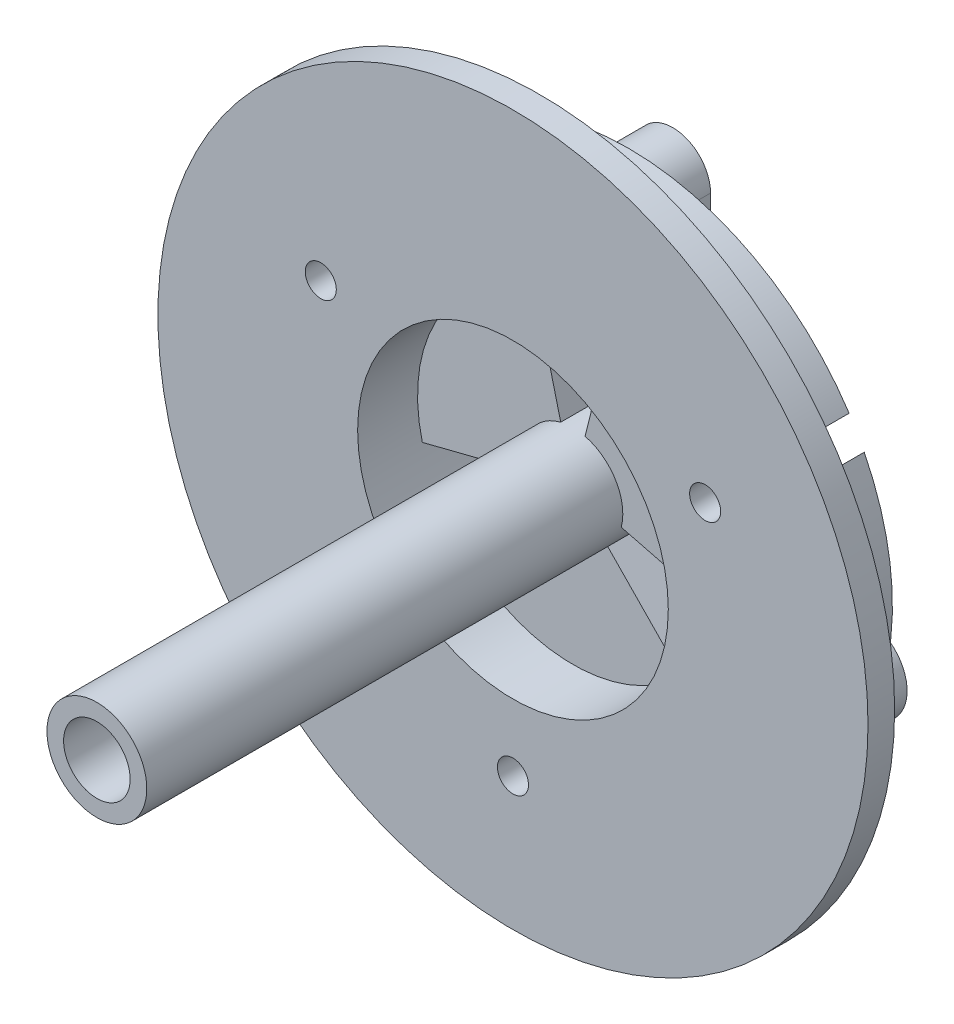
from build123d import *
from build123d.topology import SkipClean

# Parameters (mm, degrees)
SKETCH_1_R          = 16
EXTRUDE_1_DEPTH     = 1.2
SKETCH_2_R          = 7
CUT_EXTRUDE_1_DEPTH = 1.2
SKETCH_3_R          = 0.7
CUT_EXTRUDE_2_DEPTH = 1.2
SKETCH_4_R          = 0.9
EXTRUDE_2_DEPTH     = 6
SKETCH_5_R          = 7
CUT_EXTRUDE_3_DEPTH = 11
SKETCH_6_R          = 11.9
SKETCH_6_R_2        = 7
EXTRUDE_3_DEPTH     = 4
SKETCH_7_R          = 0.7
CUT_EXTRUDE_4_DEPTH = 13
SKETCH_8_R          = 2.25
EXTRUDE_4_DEPTH     = 33
EXTRUDE_START       = -2.5
EXTRUDE_5_DEPTH     = 2.5
SKETCH_10_R         = 1.5
CUT_EXTRUDE_5_DEPTH = 33.5
SKETCH_12_W         = 13.813743992
SKETCH_12_H         = 10.461201588
CUT_EXTRUDE_6_DEPTH = 16.75
SKETCH_13_R         = 2
CUT_EXTRUDE_7_DEPTH = 1.5


with BuildPart() as part:
    # 草图1 → 凸台-拉伸1 (new body)
    with BuildSketch(Plane.XY):
        Circle(SKETCH_1_R)
    extrude(amount=EXTRUDE_1_DEPTH)

    # 草图2 → 切除-拉伸1 (cut)
    with BuildSketch(Plane.XY.offset(1.2)):
        Circle(SKETCH_2_R)
    extrude(amount=-CUT_EXTRUDE_1_DEPTH, mode=Mode.SUBTRACT)

    # 草图3 → 切除-拉伸2 (cut)
    with BuildSketch(Plane.XY.offset(1.2)):
        with Locations((8.660254038, 5)):
            Circle(SKETCH_3_R)
        with Locations((0, -10)):
            Circle(SKETCH_3_R)
        with Locations((-8.660254038, 5)):
            Circle(SKETCH_3_R)
    extrude(amount=-CUT_EXTRUDE_2_DEPTH, mode=Mode.SUBTRACT)

    # 草图4 → 凸台-拉伸2 (add)
    # profile 1 of 3: a face of its own
    with BuildSketch(Plane(origin=(0, 0, 0), x_dir=(-1, 0, 0), z_dir=(0, 0, -1))):
        with BuildLine():
            Line((1.703894623, 10), (1.703894623, 5.395195442))
            Line((1.703894623, 5.395195442), (-1.703894623, 5.395195442))
            Line((-1.703894623, 5.395195442), (-1.703894623, 10))
            ThreePointArc((-1.703894623, 10), (0, 11.703894623), (1.703894623, 10))
        make_face()
        with Locations((0, 10)):
            Circle(SKETCH_4_R, mode=Mode.SUBTRACT)
    # profile 2 of 3: a face of its own
    with BuildSketch(Plane(origin=(0, 0, 0), x_dir=(-1, 0, 0), z_dir=(0, 0, -1))):
        with BuildLine():
            Line((-5.537946003, -1.003403593), (-3.637946003, -4.294300127))
            Line((-3.637946003, -4.294300127), (-7.710254038, -6.645448267))
            ThreePointArc((-7.710254038, -6.645448267), (-10.305702305, -5.95), (-9.610254038, -3.354551733))
            Line((-9.610254038, -3.354551733), (-5.537946003, -1.003403593))
        make_face()
        with Locations((-8.660254038, -5)):
            Circle(SKETCH_4_R, mode=Mode.SUBTRACT)
    # profile 3 of 3: a face of its own
    with BuildSketch(Plane(origin=(0, 0, 0), x_dir=(-1, 0, 0), z_dir=(0, 0, -1))):
        with BuildLine():
            Line((3.637946003, -4.294300127), (5.537946003, -1.003403593))
            Line((5.537946003, -1.003403593), (9.610254038, -3.354551733))
            ThreePointArc((9.610254038, -3.354551733), (10.305702305, -5.95), (7.710254038, -6.645448267))
            Line((7.710254038, -6.645448267), (3.637946003, -4.294300127))
        make_face()
        with Locations((8.660254038, -5)):
            Circle(SKETCH_4_R, mode=Mode.SUBTRACT)
    extrude(amount=EXTRUDE_2_DEPTH)

    # 草图5 → 切除-拉伸3 (cut)
    with BuildSketch(Plane.XY.offset(1.2)):
        Circle(SKETCH_5_R)
    extrude(amount=-CUT_EXTRUDE_3_DEPTH, mode=Mode.SUBTRACT)

    # 草图6 → 凸台-拉伸3 (add)
    with SkipClean():  # the faces are left unmerged after this step: merging them gives an invalid solid
        with BuildSketch(Plane(origin=(0, 0, 0), x_dir=(-1, 0, 0), z_dir=(0, 0, -1))):
            Circle(SKETCH_6_R)
            Circle(SKETCH_6_R_2, mode=Mode.SUBTRACT)
        extrude(amount=EXTRUDE_3_DEPTH)

    # 草图7 → 切除-拉伸4 (cut)
    with SkipClean():  # the faces are left unmerged after this step: merging them gives an invalid solid
        with BuildSketch(Plane.XY.offset(1.2)):
            with Locations((-8.660254038, 5)):
                Circle(SKETCH_7_R)
            with Locations((8.660254038, 5)):
                Circle(SKETCH_7_R)
            with Locations((0, -10)):
                Circle(SKETCH_7_R)
        extrude(amount=-CUT_EXTRUDE_4_DEPTH, mode=Mode.SUBTRACT)



with BuildPart() as body_2:
    # 草图8 → 凸台-拉伸4 (new body)
    with BuildSketch(Plane(origin=(0, 0, -4), x_dir=(-1, 0, 0), z_dir=(0, 0, -1))):
        Circle(SKETCH_8_R)
    extrude(amount=-EXTRUDE_4_DEPTH)


with BuildPart() as part_1:
    with SkipClean():  # the faces are left unmerged after this step: merging them gives an invalid solid
        add(part.part)

        add(body_2.part)  # 凸台-拉伸5 merges body 2
        # 草图9 → 凸台-拉伸5 (add)
        with BuildSketch(Plane(origin=(0, 0, -4), x_dir=(-1, 0, 0), z_dir=(0, 0, -1)).offset(EXTRUDE_START)):
            with BuildLine():
                Line((-1.570048426, -1.611659996), (-4.884595102, -5.01405332))
                ThreePointArc((-4.884595102, -5.01405332), (0, -7), (4.884595102, -5.01405332))
                Line((4.884595102, -5.01405332), (1.570048426, -1.611659996))
                ThreePointArc((1.570048426, -1.611659996), (0, -2.25), (-1.570048426, -1.611659996))
            make_face()
            with BuildLine():
                Line((-2.180762711, -0.553871824), (-6.784595102, -1.723156785))
                ThreePointArc((-6.784595102, -1.723156785), (-6.010804278, 3.587510548), (-1.703894623, 6.789458234))
                Line((-1.703894623, 6.789458234), (-0.547680415, 2.182325861))
                ThreePointArc((-0.547680415, 2.182325861), (-1.932044232, 1.15312839), (-2.180762711, -0.553871824))
            make_face()
            with BuildLine():
                Line((0.547680415, 2.182325861), (1.703894623, 6.789458234))
                ThreePointArc((1.703894623, 6.789458234), (6.010804278, 3.587510548), (6.784595102, -1.723156785))
                Line((6.784595102, -1.723156785), (2.180762711, -0.553871824))
                ThreePointArc((2.180762711, -0.553871824), (1.932044232, 1.15312839), (0.547680415, 2.182325861))
            make_face()
        extrude(amount=EXTRUDE_5_DEPTH)

    # 草图10 → 切除-拉伸5 (cut)
    with SkipClean():  # the faces are left unmerged after this step: merging them gives an invalid solid
        with BuildSketch(Plane(origin=(0, 0, -4), x_dir=(-1, 0, 0), z_dir=(0, 0, -1))):
            Circle(SKETCH_10_R)
        extrude(amount=-CUT_EXTRUDE_5_DEPTH, mode=Mode.SUBTRACT)

    # 草图12 → 切除-拉伸6 (cut, symmetric)
    with SkipClean():  # the faces are left unmerged after this step: merging them gives an invalid solid
        with BuildSketch(Plane(origin=(0, 0, 0), x_dir=(0, 0, -1), z_dir=(1, 0, 0))):
            with Locations((-26.856871996, 0.140862114)):
                Rectangle(SKETCH_12_W, SKETCH_12_H)
        extrude(amount=CUT_EXTRUDE_6_DEPTH, both=True, mode=Mode.SUBTRACT)

    # 草图13 → 切除-拉伸7 (cut)
    with SkipClean():  # the faces are left unmerged after this step: merging them gives an invalid solid
        with BuildSketch(Plane(origin=(0, 0, -4), x_dir=(-1, 0, 0), z_dir=(0, 0, -1))):
            with Locations((0, -10)):
                Circle(SKETCH_13_R)
            with Locations((8.660254038, 5)):
                Circle(SKETCH_13_R)
            with Locations((-8.660254038, 5)):
                Circle(SKETCH_13_R)
        extrude(amount=-CUT_EXTRUDE_7_DEPTH, mode=Mode.SUBTRACT)


solid = part_1.part
